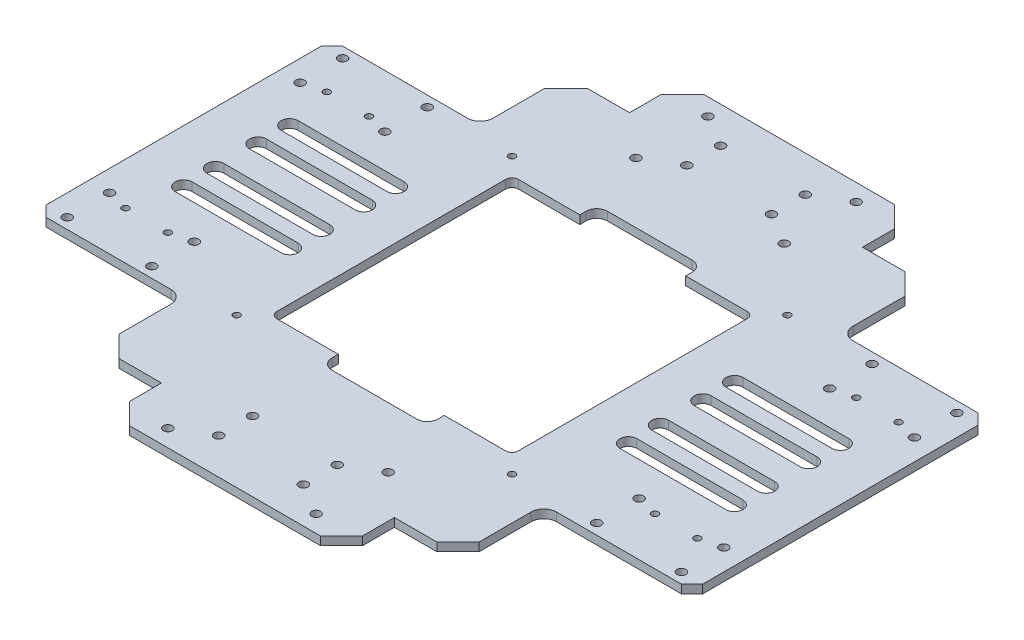
from build123d import *

# Parameters (mm, degrees)
SKETCH_1_W          = 110
SKETCH_1_H          = 270.99984649
SKETCH_1_R          = 2.1
EXTRUDE_1_DEPTH     = 4
CHAMFER_1_SIZE      = 10
CUT_EXTRUDE_1_DEPTH = 4
FILLET_1_R          = 5
EXTRUDE_2_DEPTH     = 4
CHAMFER_2_SIZE      = 10
FILLET_3_R          = 5
SKETCH_5_R          = 1.6
CUT_EXTRUDE_2_DEPTH = 4
SKETCH_7_W          = 70
SKETCH_7_H          = 140
EXTRUDE_3_DEPTH     = 4
FILLET_4_R          = 6
SKETCH_8_R          = 2.1
CUT_EXTRUDE_3_DEPTH = 4
SKETCH_9_R          = 1.6
CUT_EXTRUDE_4_DEPTH = 4
CHAMFER_3_SIZE      = 5
SKETCH_11_W         = 114
SKETCH_11_H         = 114.028365308
CUT_EXTRUDE_5_DEPTH = 10
FILLET_5_R          = 3


with BuildPart() as part:
    # 草图1 → 凸台-拉伸1 (new body)
    with BuildSketch(Plane(origin=(0, 0, 0), x_dir=(1, 0, 0), z_dir=(0, 1, 0))):
        Rectangle(SKETCH_1_W, SKETCH_1_H)
        with Locations((-35, 127.499923245)):
            Circle(SKETCH_1_R, mode=Mode.SUBTRACT)
        with Locations((-20, 118.499923245)):
            Circle(SKETCH_1_R, mode=Mode.SUBTRACT)
        with Locations((20, 118.499923245)):
            Circle(SKETCH_1_R, mode=Mode.SUBTRACT)
        with Locations((35, 127.499923245)):
            Circle(SKETCH_1_R, mode=Mode.SUBTRACT)
        with Locations((20, 102.499923245)):
            Circle(SKETCH_1_R, mode=Mode.SUBTRACT)
        with Locations((35, 93.499923245)):
            Circle(SKETCH_1_R, mode=Mode.SUBTRACT)
        with Locations((-35, 93.499923245)):
            Circle(SKETCH_1_R, mode=Mode.SUBTRACT)
        with Locations((-20, 102.499923245)):
            Circle(SKETCH_1_R, mode=Mode.SUBTRACT)
        with Locations((-35, -127.499923245)):
            Circle(SKETCH_1_R, mode=Mode.SUBTRACT)
        with Locations((-20, -118.499923245)):
            Circle(SKETCH_1_R, mode=Mode.SUBTRACT)
        with Locations((-20, -102.499923245)):
            Circle(SKETCH_1_R, mode=Mode.SUBTRACT)
        with Locations((20, -118.499923245)):
            Circle(SKETCH_1_R, mode=Mode.SUBTRACT)
        with Locations((20, -102.499923245)):
            Circle(SKETCH_1_R, mode=Mode.SUBTRACT)
        with Locations((35, -93.499923245)):
            Circle(SKETCH_1_R, mode=Mode.SUBTRACT)
        with Locations((35, -127.499923245)):
            Circle(SKETCH_1_R, mode=Mode.SUBTRACT)
    extrude(amount=EXTRUDE_1_DEPTH)

    # 倒角1
    chamfer_1_edges = [part.edges().sort_by_distance(p)[0] for p in [
        (-55, 2, 135.499923245),
        (55, 2, 135.499923245),
        (55, 2, -135.499923245),
        (-55, 2, -135.499923245),
    ]]
    chamfer(chamfer_1_edges, length=CHAMFER_1_SIZE)

    # 草图2 → 切除-拉伸1 (cut)
    with BuildSketch(Plane(origin=(0, 4, 0), x_dir=(1, 0, 0), z_dir=(0, 1, 0))):
        Polygon((-25, 45), (-40, 30), (-40, -30), (-25, -45), (-25, -65), (25, -65), (25, -45), (40, -30), (40, 30), (25, 45), (25, 65), (-25, 65), align=None)
    extrude(amount=-CUT_EXTRUDE_1_DEPTH, mode=Mode.SUBTRACT)

    # 圆角1
    fillet_1_edges = [part.edges().sort_by_distance(p)[0] for p in [
        (-25, 2, 65),
        (25, 2, 65),
        (25, 2, -65),
        (-25, 2, -65),
    ]]
    fillet(fillet_1_edges, radius=FILLET_1_R)

    # 草图3 → 凸台-拉伸2 (add)
    with BuildSketch(Plane(origin=(0, 4, 0), x_dir=(1, 0, 0), z_dir=(0, 1, 0))):
        Polygon((55, 110.499923245), (85, 110.499923245), (85, 93.499923245), (85, -102.499923245), (85, -110.499923245), (55, -110.499923245), (55, -102.499923245), (55, 93.499923245), align=None)
        Polygon((-85, 93.499923245), (-85, -102.499923245), (-85, -110.499923245), (-55, -110.499923245), (-55, -102.499923245), (-55, 93.499923245), (-55, 110.499923245), (-85, 110.499923245), align=None)
    extrude(amount=-EXTRUDE_2_DEPTH)

    # 倒角2
    chamfer_2_edges = [part.edges().sort_by_distance(p)[0] for p in [
        (-85, 2, 110.499923245),
        (85, 2, 110.499923245),
        (85, 2, -110.499923245),
        (-85, 2, -110.499923245),
    ]]
    chamfer(chamfer_2_edges, length=CHAMFER_2_SIZE)

    # 圆角3
    fillet_3_edges = [part.edges().sort_by_distance(p)[0] for p in [
        (-40, 2, 30),
        (40, 2, 30),
        (40, 2, -30),
        (-40, 2, -30),
    ]]
    fillet(fillet_3_edges, radius=FILLET_3_R)

    # 草图5 → 切除-拉伸2 (cut)
    with BuildSketch(Plane(origin=(0, 4, 0), x_dir=(1, 0, 0), z_dir=(0, 1, 0))):
        with Locations((-65, 65)):
            Circle(SKETCH_5_R)
        with Locations((65, 65)):
            Circle(SKETCH_5_R)
        with Locations((65, -65)):
            Circle(SKETCH_5_R)
        with Locations((-65, -65)):
            Circle(SKETCH_5_R)
    extrude(amount=-CUT_EXTRUDE_2_DEPTH, mode=Mode.SUBTRACT)

    # 草图7 → 凸台-拉伸3 (add)
    with BuildSketch(Plane(origin=(0, 4, 0), x_dir=(1, 0, 0), z_dir=(0, 1, 0))):
        Polygon((-85, 0), (-85, 70), (-155, 70), (-155, -70), (-85, -70), align=None)
        with Locations((120, 0)):
            Rectangle(SKETCH_7_W, SKETCH_7_H)
    extrude(amount=-EXTRUDE_3_DEPTH)

    # 圆角4
    fillet_4_edges = [part.edges().sort_by_distance(p)[0] for p in [
        (-85, 2, 70),
        (85, 2, 70),
        (85, 2, -70),
        (-85, 2, -70),
    ]]
    fillet(fillet_4_edges, radius=FILLET_4_R)

    # 草图8 → 切除-拉伸3 (cut)
    with BuildSketch(Plane(origin=(0, 4, 0), x_dir=(1, 0, 0), z_dir=(0, 1, 0))):
        with Locations((105, 65)):
            Circle(SKETCH_8_R)
        with Locations((145, 65)):
            Circle(SKETCH_8_R)
        with Locations((145, 45)):
            Circle(SKETCH_8_R)
        with Locations((105, 45)):
            Circle(SKETCH_8_R)
        with Locations((145, -45)):
            Circle(SKETCH_8_R)
        with Locations((145, -65)):
            Circle(SKETCH_8_R)
        with Locations((105, -65)):
            Circle(SKETCH_8_R)
        with Locations((105, -45)):
            Circle(SKETCH_8_R)
        with Locations((-145, 65)):
            Circle(SKETCH_8_R)
        with Locations((-105, 65)):
            Circle(SKETCH_8_R)
        with Locations((-105, 45)):
            Circle(SKETCH_8_R)
        with Locations((-145, 45)):
            Circle(SKETCH_8_R)
        with Locations((-145, -45)):
            Circle(SKETCH_8_R)
        with Locations((-105, -45)):
            Circle(SKETCH_8_R)
        with Locations((-105, -65)):
            Circle(SKETCH_8_R)
        with Locations((-145, -65)):
            Circle(SKETCH_8_R)
    extrude(amount=-CUT_EXTRUDE_3_DEPTH, mode=Mode.SUBTRACT)

    # 草图9 → 切除-拉伸4 (cut)
    with BuildSketch(Plane(origin=(0, 4, 0), x_dir=(1, 0, 0), z_dir=(0, 1, 0))):
        with Locations((-135, 47.5)):
            Circle(SKETCH_9_R)
        with Locations((-115, 47.5)):
            Circle(SKETCH_9_R)
        with Locations((-115, -47.5)):
            Circle(SKETCH_9_R)
        with Locations((-135, -47.5)):
            Circle(SKETCH_9_R)
        with Locations((135, -47.5)):
            Circle(SKETCH_9_R)
        with Locations((115, -47.5)):
            Circle(SKETCH_9_R)
        with Locations((115, 47.5)):
            Circle(SKETCH_9_R)
        with Locations((135, 47.5)):
            Circle(SKETCH_9_R)
        with BuildLine():
            Line((-130, 29.028690408), (-80, 29.028690408))
            ThreePointArc((-80, 29.028690408), (-76, 25.028690408), (-80, 21.028690408))
            Line((-80, 21.028690408), (-130, 21.028690408))
            ThreePointArc((-130, 21.028690408), (-134, 25.028690408), (-130, 29.028690408))
        make_face()
        with BuildLine():
            Line((-130, 14.028690408), (-80, 14.028690408))
            ThreePointArc((-80, 14.028690408), (-76, 10.028690408), (-80, 6.028690408))
            Line((-80, 6.028690408), (-130, 6.028690408))
            ThreePointArc((-130, 6.028690408), (-134, 10.028690408), (-130, 14.028690408))
        make_face()
        with BuildLine():
            Line((-130, -29.028690408), (-80, -29.028690408))
            ThreePointArc((-80, -29.028690408), (-76, -25.028690408), (-80, -21.028690408))
            Line((-80, -21.028690408), (-130, -21.028690408))
            ThreePointArc((-130, -21.028690408), (-134, -25.028690408), (-130, -29.028690408))
        make_face()
        with BuildLine():
            Line((-130, -14.028690408), (-80, -14.028690408))
            ThreePointArc((-80, -14.028690408), (-76, -10.028690408), (-80, -6.028690408))
            Line((-80, -6.028690408), (-130, -6.028690408))
            ThreePointArc((-130, -6.028690408), (-134, -10.028690408), (-130, -14.028690408))
        make_face()
        with BuildLine():
            Line((130, 29.028690408), (80, 29.028690408))
            ThreePointArc((80, 29.028690408), (76, 25.028690408), (80, 21.028690408))
            Line((80, 21.028690408), (130, 21.028690408))
            ThreePointArc((130, 21.028690408), (134, 25.028690408), (130, 29.028690408))
        make_face()
        with BuildLine():
            Line((130, 14.028690408), (80, 14.028690408))
            ThreePointArc((80, 14.028690408), (76, 10.028690408), (80, 6.028690408))
            Line((80, 6.028690408), (130, 6.028690408))
            ThreePointArc((130, 6.028690408), (134, 10.028690408), (130, 14.028690408))
        make_face()
        with BuildLine():
            Line((130, -29.028690408), (80, -29.028690408))
            ThreePointArc((80, -29.028690408), (76, -25.028690408), (80, -21.028690408))
            Line((80, -21.028690408), (130, -21.028690408))
            ThreePointArc((130, -21.028690408), (134, -25.028690408), (130, -29.028690408))
        make_face()
        with BuildLine():
            Line((130, -14.028690408), (80, -14.028690408))
            ThreePointArc((80, -14.028690408), (76, -10.028690408), (80, -6.028690408))
            Line((80, -6.028690408), (130, -6.028690408))
            ThreePointArc((130, -6.028690408), (134, -10.028690408), (130, -14.028690408))
        make_face()
    extrude(amount=-CUT_EXTRUDE_4_DEPTH, mode=Mode.SUBTRACT)

    # 倒角3
    chamfer_3_edges = [part.edges().sort_by_distance(p)[0] for p in [
        (155, 2, -70),
        (155, 2, 70),
        (-155, 2, 70),
        (-155, 2, -70),
    ]]
    chamfer(chamfer_3_edges, length=CHAMFER_3_SIZE)

    # 草图11 → 切除-拉伸5 (cut)
    with BuildSketch(Plane(origin=(0, 4, 0), x_dir=(1, 0, 0), z_dir=(0, 1, 0))):
        Rectangle(SKETCH_11_W, SKETCH_11_H)
    extrude(amount=-CUT_EXTRUDE_5_DEPTH, mode=Mode.SUBTRACT)

    # 圆角5
    fillet_5_edges = [part.edges().sort_by_distance(p)[0] for p in [
        (-57, 2, 57.014182654),
        (57, 2, 57.014182654),
        (57, 2, -57.014182654),
        (-57, 2, -57.014182654),
    ]]
    fillet(fillet_5_edges, radius=FILLET_5_R)


solid = part.part
